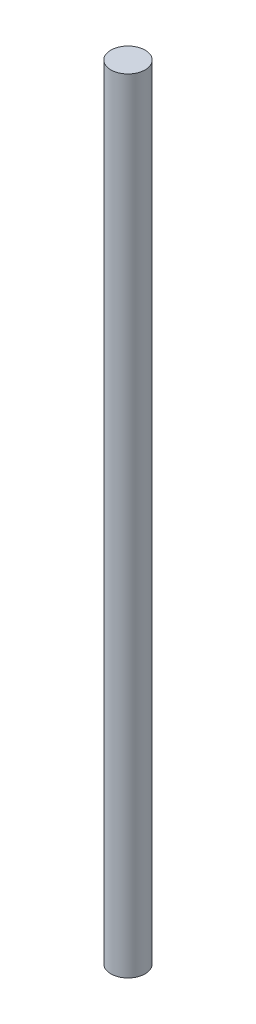
from build123d import *

# Parameters (mm, degrees)
SKETCH1_R           = 2.5
BOSS_EXTRUDE1_DEPTH = 114.3


with BuildPart() as part:
    # Sketch1 → Boss-Extrude1 (new body)
    with BuildSketch(Plane(origin=(0, 0, 0), x_dir=(1, 0, 0), z_dir=(0, 1, 0))):
        Circle(SKETCH1_R)
    extrude(amount=BOSS_EXTRUDE1_DEPTH)


solid = part.part
